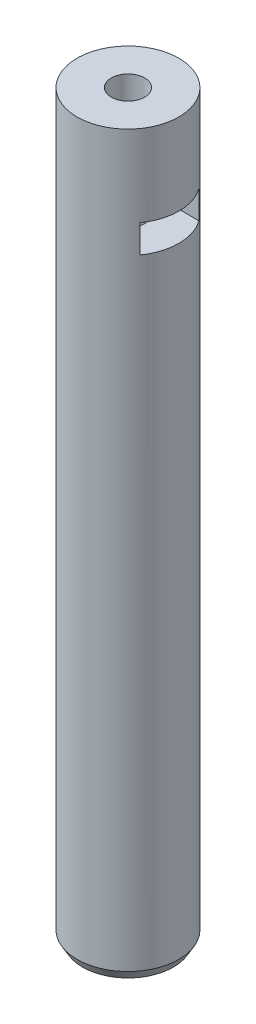
from build123d import *

# Parameters (mm, degrees)
SKETCH2_R           = 9.3
BOSS_EXTRUDE1_DEPTH = 135
CHAMFER1_SIZE       = 1
CHAMFER1_SIZE2      = 1.732050808
SKETCH3_R           = 3.05
CUT_EXTRUDE1_DEPTH  = 25
CUT_EXTRUDE2_DEPTH  = 5.1


with BuildPart() as part:
    # Sketch2 → Boss-Extrude1 (new body)
    with BuildSketch(Plane(origin=(0, 0, 0), x_dir=(1, 0, 0), z_dir=(0, 1, 0))):
        Circle(SKETCH2_R)
    extrude(amount=BOSS_EXTRUDE1_DEPTH)

    # Chamfer1
    chamfer1_edges = [part.edges().sort_by_distance(p)[0] for p in [
        (-9.3, 0, 0),
    ]]
    chamfer1_side = [part.faces().sort_by_distance(p)[0] for p in [
        (0, 0, 0),
    ]]
    chamfer(chamfer1_edges, length=CHAMFER1_SIZE, length2=CHAMFER1_SIZE2, reference=chamfer1_side[0])

    # Sketch3 → Cut-Extrude1 (cut)
    with BuildSketch(Plane(origin=(0, 135, 0), x_dir=(1, 0, 0), z_dir=(0, 1, 0))):
        Circle(SKETCH3_R)
    extrude(amount=-CUT_EXTRUDE1_DEPTH, mode=Mode.SUBTRACT)

    # Sketch4 → Cut-Extrude2 (cut)
    with BuildSketch(Plane(origin=(0, 115, 0), x_dir=(1, 0, 0), z_dir=(0, 1, 0))):
        with BuildLine():
            Line((3.12, 5.40399852), (7.568804397, 5.40399852))
            ThreePointArc((7.568804397, 5.40399852), (9.3, 0), (7.568804397, -5.40399852))
            Line((7.568804397, -5.40399852), (3.12, -5.40399852))
            Line((3.12, -5.40399852), (-3.12, -5.40399852))
            Line((-3.12, -5.40399852), (-6.24, 0))
            Line((-6.24, 0), (-3.12, 5.40399852))
            Line((-3.12, 5.40399852), (3.12, 5.40399852))
        make_face()
    extrude(amount=CUT_EXTRUDE2_DEPTH, mode=Mode.SUBTRACT)


solid = part.part
